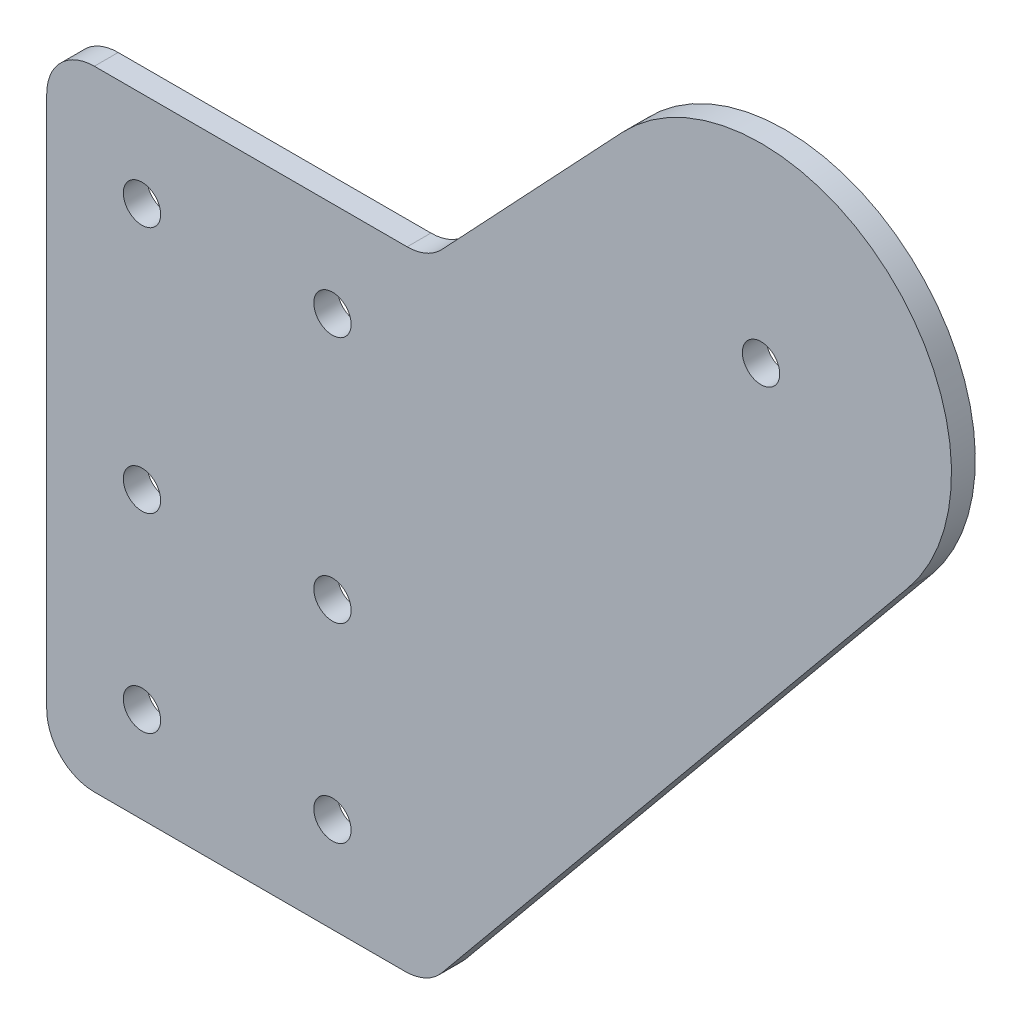
from build123d import *

# Parameters (mm, degrees)
SKETCH2_R           = 2.4892
BOSS_EXTRUDE1_DEPTH = 3.175
SKETCH3_R           = 2.4892
CUT_EXTRUDE1_DEPTH  = 170.758910002
FILLET1_R           = 6.35


with BuildPart() as part:
    # Sketch2 → Boss-Extrude1 (new body)
    with BuildSketch(Plane.XY):
        with BuildLine():
            Line((50.8, 83.82), (76.756103851, 111.390795652))
            ThreePointArc((76.756103851, 111.390795652), (112.035132918, 113.043559818), (114.862067576, 77.839157228))
            Line((114.862067576, 77.839157228), (50.8, 0))
            Line((50.8, 0), (0, 0))
            Line((0, 0), (0, 83.82))
            Line((0, 83.82), (50.8, 83.82))
        make_face()
        with Locations((95.25, 93.98)):
            Circle(SKETCH2_R, mode=Mode.SUBTRACT)
    extrude(amount=-BOSS_EXTRUDE1_DEPTH)

    # Sketch3 → Cut-Extrude1 (cut, through all)
    with BuildSketch(Plane.XY):
        with Locations((12.7, 71.12)):
            Circle(SKETCH3_R)
        with Locations((38.1, 71.12)):
            Circle(SKETCH3_R)
        with Locations((12.7, 38.1)):
            Circle(SKETCH3_R)
        with Locations((12.7, 12.7)):
            Circle(SKETCH3_R)
        with Locations((12.7, -12.7)):
            Circle(SKETCH3_R)
        with Locations((12.7, -38.1)):
            Circle(SKETCH3_R)
        with Locations((12.7, -63.5)):
            Circle(SKETCH3_R)
        with Locations((38.1, 12.7)):
            Circle(SKETCH3_R)
        with Locations((38.1, -12.7)):
            Circle(SKETCH3_R)
        with Locations((38.1, -38.1)):
            Circle(SKETCH3_R)
        with Locations((38.1, -63.5)):
            Circle(SKETCH3_R)
        with Locations((38.1, 38.1)):
            Circle(SKETCH3_R)
    extrude(amount=-CUT_EXTRUDE1_DEPTH, mode=Mode.SUBTRACT)

    # Fillet1
    fillet1_edges = [part.edges().sort_by_distance(p)[0] for p in [
        (0, 0, -1.5875),
        (50.8, 0, -1.5875),
        (50.8, 83.82, -1.5875),
        (0, 83.82, -1.5875),
    ]]
    fillet(fillet1_edges, radius=FILLET1_R)


solid = part.part
